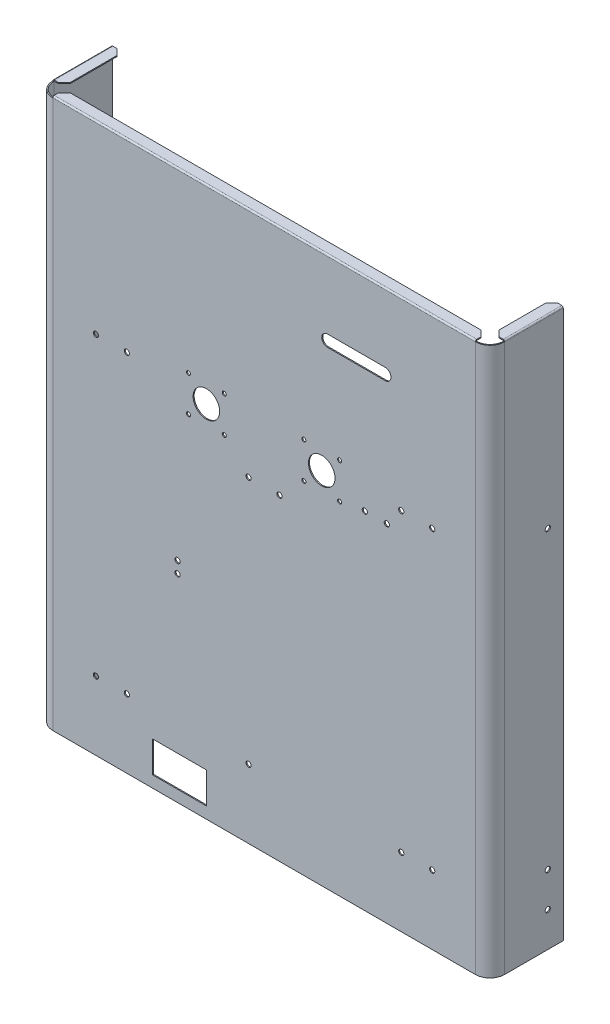
from build123d import *

# Parameters (mm, degrees)
BASE_FLANGE2_DEPTH         = 475
SKETCH13_R                 = 2.25
CUT_EXTRUDE4_DEPTH         = 619.939427235
SKETCH14_R                 = 11.5
SKETCH14_R_2               = 1.75
STEPPER_MOTOR_CUTOUT_DEPTH = 0.889
SKETCH15_R                 = 2.25
CUT_EXTRUDE6_DEPTH         = 0.889
SKETCH16_W                 = 46.8
SKETCH16_H                 = 27
CUT_EXTRUDE7_DEPTH         = 0.889
M4_CLEARANCE_HOLE1_D       = 4.5
EDGE_FLANGE1_DEPTH         = 50.8
EDGE_FLANGE1_BEND_DEPTH    = 366.29983991
EDGE_FLANGE1_BEND_2_DEPTH  = 50.8
BREAK_CORNER1_START        = 475.381
BREAK_CORNER1_DEPTH        = 0.889
CUT_EXTRUDE8_DEPTH         = 10
M4_CLEARANCE_HOLE2_D       = 4.5
M4_CLEARANCE_HOLE3_D       = 4.5


# Read off the part's stored shape, not the designer's step: Break-Corner1
# Sheet-metal steps are written as plain solids
with BuildPart() as part:
    # Sketch1 → Base-Flange2 (new body)
    with BuildSketch(Plane(origin=(0, 0, 0), x_dir=(1, 0, 0), z_dir=(0, 1, 0))):
        with BuildLine():
            Line((195.849919955, 63.5), (195.849919955, 12.7))
            ThreePointArc((195.849919955, 12.7), (192.130176076, 3.719743879), (183.149919955, 0))
            Line((183.149919955, 0), (-183.149919955, 0))
            ThreePointArc((-183.149919955, 0), (-192.130176076, 3.719743879), (-195.849919955, 12.7))
            Line((-195.849919955, 12.7), (-195.849919955, 63.5))
            Line((-195.849919955, 63.5), (-194.960919955, 63.5))
            Line((-194.960919955, 63.5), (-194.960919955, 12.7))
            ThreePointArc((-194.960919955, 12.7), (-191.501558148, 4.348361807), (-183.149919955, 0.889))
            Line((-183.149919955, 0.889), (183.149919955, 0.889))
            ThreePointArc((183.149919955, 0.889), (191.501558148, 4.348361807), (194.960919955, 12.7))
            Line((194.960919955, 12.7), (194.960919955, 63.5))
            Line((194.960919955, 63.5), (195.849919955, 63.5))
        make_face()
    extrude(amount=BASE_FLANGE2_DEPTH)

    # Sketch13 → Cut-Extrude4 (cut, through all)
    with BuildSketch(Plane(origin=(195.849919955, 0, 0), x_dir=(0, 0, -1), z_dir=(1, 0, 0))):
        with Locations((50.096107, 60)):
            Circle(SKETCH13_R)
        with Locations((50.096107, 316.132840032)):
            Circle(SKETCH13_R)
        with Locations((50.096107, 30)):
            Circle(SKETCH13_R)
    extrude(amount=-CUT_EXTRUDE4_DEPTH, mode=Mode.SUBTRACT)

    # Sketch14 → Stepper motor cutout (cut)
    with BuildSketch(Plane.XY):
        with Locations((50, 311.73292)):
            Circle(SKETCH14_R)
        with Locations((34.5, 296.23292)):
            Circle(SKETCH14_R_2)
        with Locations((65.5, 296.23292)):
            Circle(SKETCH14_R_2)
        with Locations((34.5, 327.23292)):
            Circle(SKETCH14_R_2)
        with Locations((65.5, 327.23292)):
            Circle(SKETCH14_R_2)
        with Locations((-50, 311.73292)):
            Circle(SKETCH14_R)
        with Locations((-65.5, 296.23292)):
            Circle(SKETCH14_R_2)
        with Locations((-34.5, 296.23292)):
            Circle(SKETCH14_R_2)
        with Locations((-65.5, 327.23292)):
            Circle(SKETCH14_R_2)
        with Locations((-34.5, 327.23292)):
            Circle(SKETCH14_R_2)
    extrude(amount=-STEPPER_MOTOR_CUTOUT_DEPTH, mode=Mode.SUBTRACT)

    # Sketch15 → Cut-Extrude6 (cut)
    with BuildSketch(Plane.XY):
        with Locations((-145.753812955, 316.132839976)):
            Circle(SKETCH15_R)
        with Locations((-118.946026845, 316.132839976)):
            Circle(SKETCH15_R)
        with Locations((118.946026845, 316.132839976)):
            Circle(SKETCH15_R)
        with Locations((145.753812955, 316.132839976)):
            Circle(SKETCH15_R)
        with Locations((145.753812955, 59.61392)):
            Circle(SKETCH15_R)
        with Locations((118.946026845, 59.61392)):
            Circle(SKETCH15_R)
        with Locations((-118.946026845, 59.61392)):
            Circle(SKETCH15_R)
        with Locations((-145.753812955, 59.61392)):
            Circle(SKETCH15_R)
    extrude(amount=-CUT_EXTRUDE6_DEPTH, mode=Mode.SUBTRACT)

    # Sketch16 → Cut-Extrude7 (cut)
    with BuildSketch(Plane.XY):
        with Locations((-73.4, 23.5)):
            Rectangle(SKETCH16_W, SKETCH16_H)
    extrude(amount=-CUT_EXTRUDE7_DEPTH, mode=Mode.SUBTRACT)

    # M4 Clearance Hole1 (through all)
    with Locations(Plane.XY):
        with Locations((-75, 181.73292), (-75, 171.73292)):
            Hole(M4_CLEARANCE_HOLE1_D / 2)

    # Edge-Flange1 section (across the edge) → Edge-Flange1 (add)
    with BuildSketch(Plane(origin=(-194.960919955, 475.381, -63.5), x_dir=(0, -1, 0), z_dir=(0, 0, 1))):
        with BuildLine():
            Line((-0.889, 0.381), (-0.889, 9.111))
            Line((-0.889, 9.111), (0, 9.111))
            Line((0, 9.111), (0, 0.381))
            ThreePointArc((0, 0.381), (0.111592316, 0.111592316), (0.381, 0))
            Line((0.381, 0), (0.381, -0.889))
            ThreePointArc((0.381, -0.889), (-0.517025612, -0.517025612), (-0.889, 0.381))
        make_face()
    extrude(amount=EDGE_FLANGE1_DEPTH)

    # Edge-Flange1 section 2 (across the edge) → Edge-Flange1 bend (add)
    with BuildSketch(Plane(origin=(-183.149919955, 475.381, -0.889), x_dir=(0, -1, 0), z_dir=(1, 0, 0))):
        with BuildLine():
            Line((-0.889, 0.381), (-0.889, 9.111))
            Line((-0.889, 9.111), (0, 9.111))
            Line((0, 9.111), (0, 0.381))
            ThreePointArc((0, 0.381), (0.111592316, 0.111592316), (0.381, 0))
            Line((0.381, 0), (0.381, -0.889))
            ThreePointArc((0.381, -0.889), (-0.517025612, -0.517025612), (-0.889, 0.381))
        make_face()
    extrude(amount=EDGE_FLANGE1_BEND_DEPTH)

    # Edge-Flange1 section 3 (across the edge) → Edge-Flange1 bend 2 (add)
    with BuildSketch(Plane(origin=(194.960919955, 475.381, -12.7), x_dir=(0, -1, 0), z_dir=(0, 0, -1))):
        with BuildLine():
            Line((-0.889, 0.381), (-0.889, 9.111))
            Line((-0.889, 9.111), (0, 9.111))
            Line((0, 9.111), (0, 0.381))
            ThreePointArc((0, 0.381), (0.111592316, 0.111592316), (0.381, 0))
            Line((0.381, 0), (0.381, -0.889))
            ThreePointArc((0.381, -0.889), (-0.517025612, -0.517025612), (-0.889, 0.381))
        make_face()
    extrude(amount=EDGE_FLANGE1_BEND_2_DEPTH)

    # Break-Corner1 outline → Break-Corner1 (cut)
    with BuildSketch(Plane(origin=(0, 0, 0), x_dir=(1, 0, 0), z_dir=(0, 1, 0)).offset(BREAK_CORNER1_START)):
        Polygon((183.149919955, 10), (178.149919955, 10), (183.149919955, 5), align=None)
        Polygon((-183.149919955, 5), (-178.149919955, 10), (-183.149919955, 10), align=None)
        Polygon((185.849919955, 63.5), (185.849919955, 58.5), (190.849919955, 63.5), align=None)
        Polygon((190.849919955, 12.7), (185.849919955, 17.7), (185.849919955, 12.7), align=None)
        Polygon((-185.849919955, 63.5), (-190.849919955, 63.5), (-185.849919955, 58.5), align=None)
        Polygon((-185.849919955, 12.7), (-185.849919955, 17.7), (-190.849919955, 12.7), align=None)
    extrude(amount=BREAK_CORNER1_DEPTH, mode=Mode.SUBTRACT)

    # Sketch29 → Cut-Extrude8 (cut)
    with BuildSketch(Plane.XY):
        with BuildLine():
            Line((55, 416.73292), (105, 416.73292))
            ThreePointArc((105, 416.73292), (110, 411.73292), (105, 406.73292))
            Line((105, 406.73292), (55, 406.73292))
            ThreePointArc((55, 406.73292), (50, 411.73292), (55, 416.73292))
        make_face()
    extrude(amount=-CUT_EXTRUDE8_DEPTH, mode=Mode.SUBTRACT)

    # M4 Clearance Hole2 (through all)
    with Locations(Plane(origin=(0, 0, -0.889), x_dir=(-1, 0, 0), z_dir=(0, 0, -1))):
        with Locations((-13.403893, 275), (13.403893, 275), (13.403893, 59.61392)):
            Hole(M4_CLEARANCE_HOLE2_D / 2)

    # M4 Clearance Hole3 (through all)
    with Locations(Plane(origin=(0, 0, -0.889), x_dir=(-1, 0, 0), z_dir=(0, 0, -1))):
        with Locations((-106.393607124, 300), (-87.343607124, 300)):
            Hole(M4_CLEARANCE_HOLE3_D / 2)


solid = part.part
